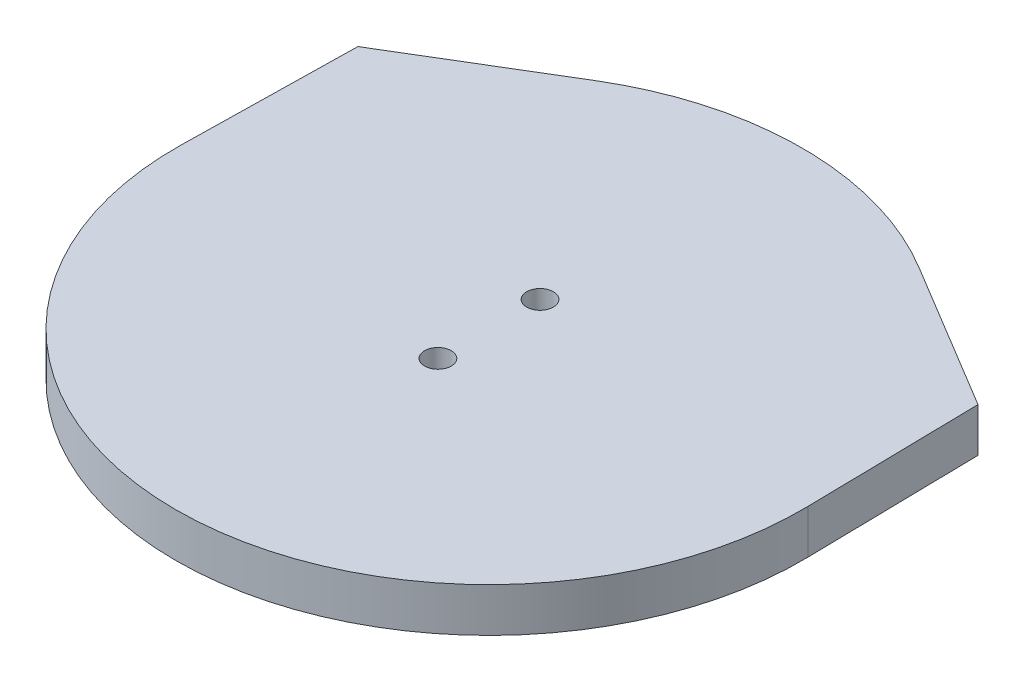
from build123d import *

# Parameters (mm, degrees)
BOSS_EXTRUDE4_DEPTH                             = 5.6
CSK_FOR_M3_FLAT_HEAD_MACHINE_SCREW1_D           = 3.4
CSK_FOR_M3_FLAT_HEAD_MACHINE_SCREW1_CSINK_D     = 6.3
CSK_FOR_M3_FLAT_HEAD_MACHINE_SCREW1_CSINK_ANGLE = 90


with BuildPart() as part:
    # Sketch6 → Boss-Extrude4 (new body)
    with BuildSketch(Plane(origin=(0, 0, 0), x_dir=(1, 0, 0), z_dir=(0, 1, 0))):
        with BuildLine():
            Line((-37.735031535, 17.5893733), (-18.832983626, 28.967073503))
            ThreePointArc((-18.832983626, 28.967073503), (1.730983294, 34.678659015), (22.294950215, 28.967073503))
            Line((22.294950215, 28.967073503), (41.196998124, 17.5893733))
            Line((41.196998124, 17.5893733), (41.599351581, -4.469130473))
            ThreePointArc((41.599351581, -4.469130473), (1.730983294, -45.071340985), (-38.137384993, -4.469130473))
            Line((-38.137384993, -4.469130473), (-37.735031535, 17.5893733))
        make_face()
    extrude(amount=BOSS_EXTRUDE4_DEPTH)

    # CSK for M3 Flat Head Machine Screw1 (through all)
    with Locations(Plane(origin=(0, 0, 5.6), x_dir=(1, 0, 0), z_dir=(0, -1, 0))):
        with Locations((1.730983294, -6.903659015), (1.730983294, 6.096340985)):
            CounterSinkHole(CSK_FOR_M3_FLAT_HEAD_MACHINE_SCREW1_D / 2, CSK_FOR_M3_FLAT_HEAD_MACHINE_SCREW1_CSINK_D / 2, counter_sink_angle=CSK_FOR_M3_FLAT_HEAD_MACHINE_SCREW1_CSINK_ANGLE)


solid = part.part
